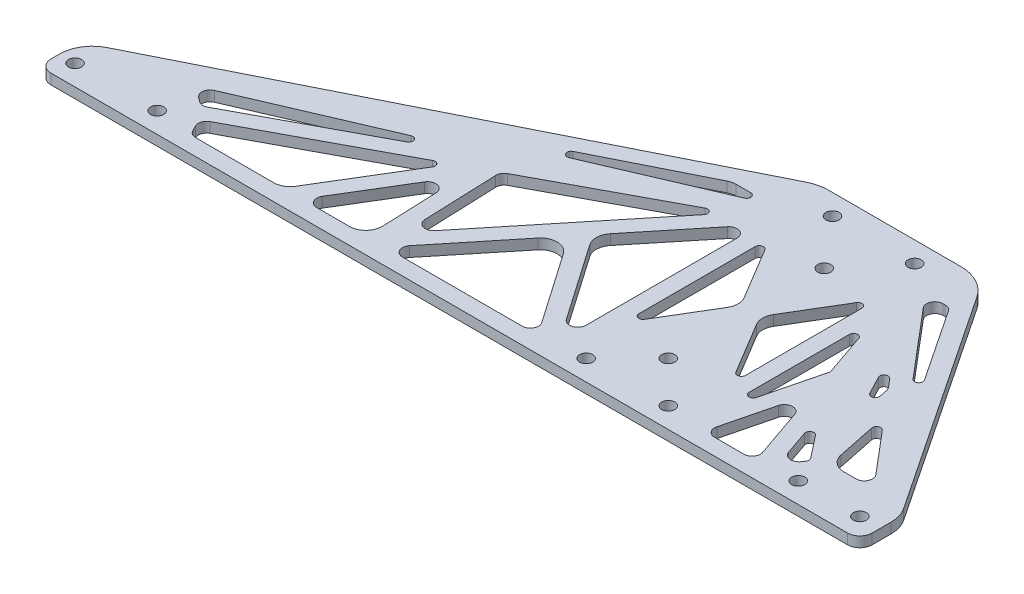
from build123d import *

# Parameters (mm, degrees)
SKETCH1_R           = 2.032
BOSS_EXTRUDE1_DEPTH = 3.175
SKETCH1_3_R         = 2.032
CUT_EXTRUDE2_DEPTH  = 270.126904313
FILLET1_R           = 3.81
FILLET2_R           = 10.16
FILLET3_R           = 12.7
FILLET4_R           = 1.27
FILLET5_R           = 2.54
FILLET6_R           = 5.08


with BuildPart() as part:
    # Sketch1 → Boss-Extrude1 (new body)
    with BuildSketch(Plane(origin=(0, 0, 0), x_dir=(1, 0, 0), z_dir=(0, 1, 0))):
        Polygon((0, 0), (254, 0), (254, 12.7), (203.2, 88.9), (152.4, 88.9), (0, 12.7), align=None)
        with Locations((4.868333333, 6.35)):
            Circle(SKETCH1_R, mode=Mode.SUBTRACT)
        with Locations((30.268333333, 6.35)):
            Circle(SKETCH1_R, mode=Mode.SUBTRACT)
        with Locations((228.6, 6.35)):
            Circle(SKETCH1_R, mode=Mode.SUBTRACT)
        with Locations((247.65, 6.35)):
            Circle(SKETCH1_R, mode=Mode.SUBTRACT)
        with Locations((162.983333333, 82.55)):
            Circle(SKETCH1_R, mode=Mode.SUBTRACT)
        with Locations((188.383333333, 82.55)):
            Circle(SKETCH1_R, mode=Mode.SUBTRACT)
    extrude(amount=BOSS_EXTRUDE1_DEPTH)

    # Sketch1<3> → Cut-Extrude2 (cut, through all)
    with BuildSketch(Plane(origin=(0, 0, 0), x_dir=(1, 0, 0), z_dir=(0, 1, 0))):
        Polygon((39.160127309, 10.433958769), (41.874510307, 5.08), (70.459110655, 5.08), (90.331883407, 37.826895453), align=None)
        Polygon((76.401361816, 5.08), (96.288373818, 5.08), (95.107733837, 35.904868603), align=None)
        Polygon((127.570752901, 36.414671497), (102.103358932, 5.08), (149.298298116, 5.08), align=None)
        Polygon((150.195302167, 76.2), (138.359225326, 76.2), (66.419120067, 40.229947371), align=None)
        Polygon((29.646805141, 18.912972806), (35.757110623, 14.374351834), (103.353340378, 50.559532546), align=None)
        Polygon((154.093333333, 69.047627429), (130.906568677, 40.519005519), (154.093333333, 7.079901082), align=None)
        Polygon((146.694432915, 67.998534414), (99.921228518, 42.960202251), (101.110396846, 11.912670369), align=None)
        with Locations((162.983333333, 6.35)):
            Circle(SKETCH1_3_R)
        Polygon((233.45048443, 34.366173115), (205.561266507, 76.2), (198.060312203, 76.2), align=None)
        Polygon((207.411621605, 31.741918623), (200.727780974, 5.08), (216.626583121, 5.08), align=None)
        with Locations((188.383333333, 6.35)):
            Circle(SKETCH1_3_R)
        Polygon((214.360813589, 27.186853093), (221.088734871, 7.720760975), (225.03662739, 13.595166828), align=None)
        Polygon((197.273333333, 61.075325647), (197.273333333, 12.191395039), (204.376138918, 40.524569775), align=None)
        Polygon((172.721209771, 44.45), (159.173333333, 67.029794062), (159.173333333, 21.870205938), align=None)
        Polygon((229.119714982, 15.811166321), (242.49351009, 15.811166321), (224.788319061, 36.740024529), align=None)
        Polygon((217.920532914, 44.858260713), (207.815682967, 56.802948088), (220.392582257, 32.913573338), align=None)
        Polygon((192.193333333, 67.029794062), (178.645456896, 44.45), (192.193333333, 21.870205938), align=None)
        with Locations((175.683333333, 19.05)):
            Circle(SKETCH1_3_R)
        with Locations((175.683333333, 67.31)):
            Circle(SKETCH1_3_R)
    extrude(amount=CUT_EXTRUDE2_DEPTH, mode=Mode.SUBTRACT)

    # Fillet1
    fillet1_edges = [part.edges().sort_by_distance(p)[0] for p in [
        (254, 1.5875, 0),
        (0, 1.5875, 0),
    ]]
    fillet(fillet1_edges, radius=FILLET1_R)

    # Fillet2
    fillet2_edges = [part.edges().sort_by_distance(p)[0] for p in [
        (254, 1.5875, -12.7),
        (0, 1.5875, -12.7),
    ]]
    fillet(fillet2_edges, radius=FILLET2_R)

    # Fillet3
    fillet3_edges = [part.edges().sort_by_distance(p)[0] for p in [
        (203.2, 1.5875, -88.9),
        (152.4, 1.5875, -88.9),
    ]]
    fillet(fillet3_edges, radius=FILLET3_R)

    # Fillet4
    fillet4_edges = [part.edges().sort_by_distance(p)[0] for p in [
        (214.360813589, 1.5875, -27.186853093),
        (233.45048443, 1.5875, -34.366173115),
        (207.815682967, 1.5875, -56.802948088),
        (220.392582257, 1.5875, -32.913573338),
        (197.273333333, 1.5875, -61.075325647),
        (197.273333333, 1.5875, -12.191395039),
        (159.173333333, 1.5875, -67.029794062),
        (192.193333333, 1.5875, -67.029794062),
        (192.193333333, 1.5875, -21.870205938),
        (159.173333333, 1.5875, -21.870205938),
        (146.694432915, 1.5875, -67.998534414),
        (66.419120067, 1.5875, -40.229947371),
        (150.195302167, 1.5875, -76.2),
        (224.788319061, 1.5875, -36.740024529),
        (103.353340378, 1.5875, -50.559532546),
        (90.331883407, 1.5875, -37.826895453),
        (225.03662739, 1.5875, -13.595166828),
    ]]
    fillet(fillet4_edges, radius=FILLET4_R)

    # Fillet5
    fillet5_edges = [part.edges().sort_by_distance(p)[0] for p in [
        (39.160127309, 1.5875, -10.433958769),
        (41.874510307, 1.5875, -5.08),
        (99.921228518, 1.5875, -42.960202251),
        (101.110396846, 1.5875, -11.912670369),
        (95.107733837, 1.5875, -35.904868603),
        (76.401361816, 1.5875, -5.08),
        (35.757110623, 1.5875, -14.374351834),
        (29.646805141, 1.5875, -18.912972806),
        (198.060312203, 1.5875, -76.2),
        (205.561266507, 1.5875, -76.2),
        (217.920532914, 1.5875, -44.858260713),
        (242.49351009, 1.5875, -15.811166321),
        (221.088734871, 1.5875, -7.720760975),
        (216.626583121, 1.5875, -5.08),
        (200.727780974, 1.5875, -5.08),
        (207.411621605, 1.5875, -31.741918623),
        (154.093333333, 1.5875, -69.047627429),
        (149.298298116, 1.5875, -5.08),
        (102.103358932, 1.5875, -5.08),
        (154.093333333, 1.5875, -7.079901082),
    ]]
    fillet(fillet5_edges, radius=FILLET5_R)

    # Fillet6
    fillet6_edges = [part.edges().sort_by_distance(p)[0] for p in [
        (229.119714982, 1.5875, -15.811166321),
        (96.288373818, 1.5875, -5.08),
        (172.721209771, 1.5875, -44.45),
        (178.645456896, 1.5875, -44.45),
        (130.906568677, 1.5875, -40.519005519),
        (127.570752901, 1.5875, -36.414671497),
        (138.359225326, 1.5875, -76.2),
        (70.459110655, 1.5875, -5.08),
    ]]
    fillet(fillet6_edges, radius=FILLET6_R)


solid = part.part
